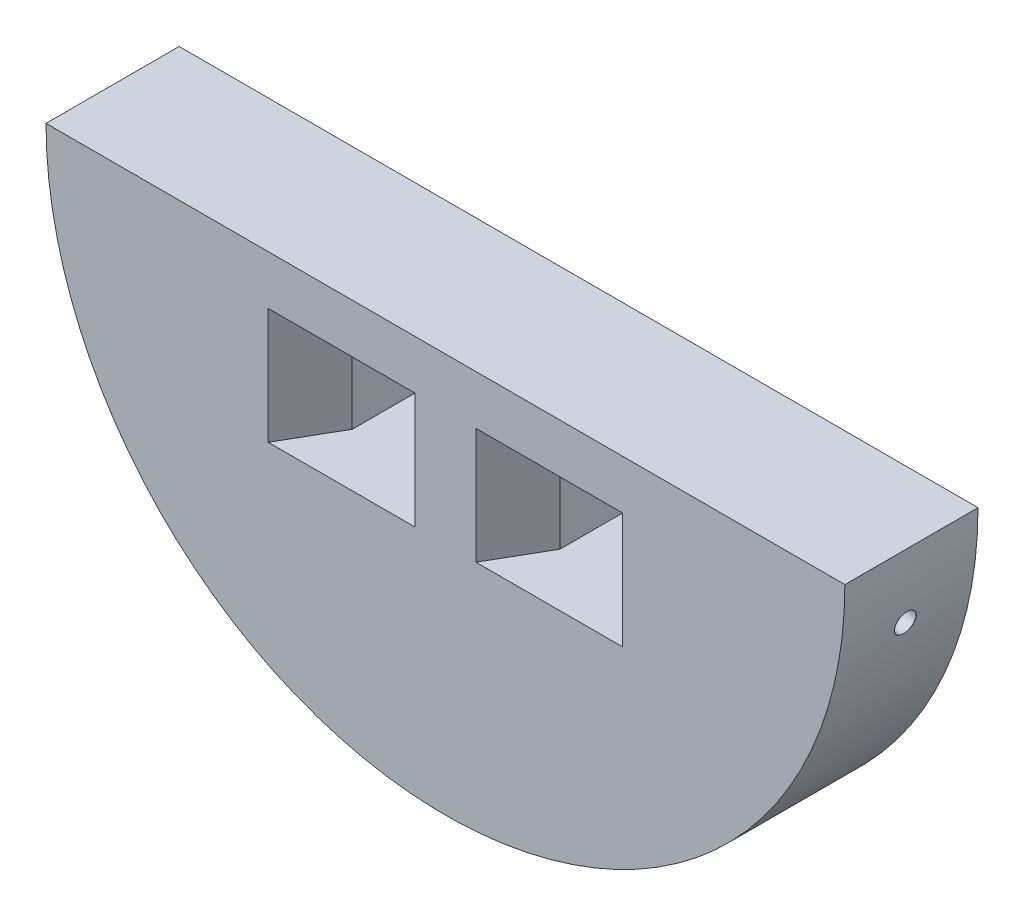
from build123d import *
from OCP.BRepFilletAPI import BRepFilletAPI_MakeChamfer

# Parameters (mm, degrees)
SKETCH1_W           = 16
SKETCH1_H           = 16
BOSS_EXTRUDE1_DEPTH = 25
CIRPATTERN1_COUNT   = 5
CIRPATTERN1_ANGLE   = 160
CHAMFER1_SIZE       = 15
CHAMFER1_SIZE2      = 8.660254038
CHAMFER3_SIZE       = 10
CHAMFER3_SIZE_2     = 5.773502692


with BuildPart() as part:
    # Sketch1 → Boss-Extrude1 (new body)
    with BuildSketch(Plane.XY):
        with BuildLine():
            Line((-150, 0), (0, 0))
            ThreePointArc((0, 0), (-75, -75), (-150, 0))
        make_face()
        with Locations((-55.5, -23)):
            Rectangle(SKETCH1_W, SKETCH1_H, mode=Mode.SUBTRACT)
        with Locations((-94.5, -23)):
            Rectangle(SKETCH1_W, SKETCH1_H, mode=Mode.SUBTRACT)
    extrude(amount=BOSS_EXTRUDE1_DEPTH)

    # Sketch4 → Ø4.0mm Dowel Hole2 (revolve, cut)
    with BuildSketch(Plane(origin=(-1.139418524, -13.023613325, 12.5), x_dir=(0.17364817766693047, 0.9848077530122081, 0), z_dir=(0, 0, 1))):
        Polygon((0, 0), (0, 17.201721238), (2, 16), (2, 0.025), (2.025, 0), align=None)
    f_4_0mm_dowel_hole2 = revolve(axis=Axis((5.114110708, -14.126279253, 12.5), (-0.9848077530122081, 0.17364817766693044, 0)), mode=Mode.SUBTRACT)

    # CirPattern1: Ø4.0mm Dowel Hole2 ×5 about axis
    cirpattern1_axis = Axis((-75, 0, 0), (0, 0, -1))
    for i in range(1, CIRPATTERN1_COUNT):
        add(f_4_0mm_dowel_hole2.rotate(cirpattern1_axis, i * CIRPATTERN1_ANGLE / (CIRPATTERN1_COUNT - 1)), mode=Mode.SUBTRACT)

    # Chamfer1: one chamfer whose edges measure the first distance from different faces: ONE call of the kernel's chamfer builder (chamfer() names one face for all edges)
    chamfer1_edges_1 = [part.edges().sort_by_distance(p)[0] for p in [
        (-55.5, -15, 0),
    ]]
    chamfer1_side_1 = [part.faces().sort_by_distance(p)[0] for p in [
        (-55.5, -15, 12.5),
    ]]
    chamfer1_edges_2 = [part.edges().sort_by_distance(p)[0] for p in [
        (-94.5, -15, 0),
    ]]
    chamfer1_side_2 = [part.faces().sort_by_distance(p)[0] for p in [
        (-94.5, -15, 12.5),
    ]]
    chamfer1 = BRepFilletAPI_MakeChamfer(part.part.solid().wrapped)
    for e in chamfer1_edges_1:
        chamfer1.Add(CHAMFER1_SIZE, CHAMFER1_SIZE2, e.wrapped, chamfer1_side_1[0].wrapped)  # the first distance lies on this face
    for e in chamfer1_edges_2:
        chamfer1.Add(CHAMFER1_SIZE, CHAMFER1_SIZE2, e.wrapped, chamfer1_side_2[0].wrapped)  # the first distance lies on this face
    add(Compound.cast(chamfer1.Shape()), mode=Mode.REPLACE)

    # Chamfer3
    chamfer3_edges_1 = [part.edges().sort_by_distance(p)[0] for p in [
        (-102.5, -23, 25),
    ]]
    chamfer3_side_1 = [part.faces().sort_by_distance(p)[0] for p in [
        (-102.5, -23, 24.884529946),
    ]]
    chamfer3_edges_2 = [part.edges().sort_by_distance(p)[0] for p in [
        (-94.5, -15, 25),
    ]]
    chamfer3_side_2 = [part.faces().sort_by_distance(p)[0] for p in [
        (-94.5, -14.884529946, 25),
    ]]
    chamfer3_edges_3 = [part.edges().sort_by_distance(p)[0] for p in [
        (-86.5, -23, 25),
    ]]
    chamfer3_side_3 = [part.faces().sort_by_distance(p)[0] for p in [
        (-86.5, -23, 24.884529946),
    ]]
    chamfer3_edges_4 = [part.edges().sort_by_distance(p)[0] for p in [
        (-47.5, -23, 25),
    ]]
    chamfer3_side_4 = [part.faces().sort_by_distance(p)[0] for p in [
        (-47.5, -23, 24.884529946),
    ]]
    chamfer3_edges_5 = [part.edges().sort_by_distance(p)[0] for p in [
        (-55.5, -15, 25),
    ]]
    chamfer3_side_5 = [part.faces().sort_by_distance(p)[0] for p in [
        (-55.5, -15, 24.884529946),
    ]]
    chamfer3_edges_6 = [part.edges().sort_by_distance(p)[0] for p in [
        (-63.5, -23, 25),
    ]]
    chamfer3_side_6 = [part.faces().sort_by_distance(p)[0] for p in [
        (-63.5, -23, 24.884529946),
    ]]
    chamfer3 = BRepFilletAPI_MakeChamfer(part.part.solid().wrapped)
    for e in chamfer3_edges_1:
        chamfer3.Add(CHAMFER3_SIZE - 0.0001, CHAMFER3_SIZE_2 - 0.0001, e.wrapped, chamfer3_side_1[0].wrapped)
    for e in chamfer3_edges_2:
        chamfer3.Add(CHAMFER3_SIZE_2 - 0.0001, CHAMFER3_SIZE - 0.0001, e.wrapped, chamfer3_side_2[0].wrapped)
    for e in chamfer3_edges_3:
        chamfer3.Add(CHAMFER3_SIZE - 0.0001, CHAMFER3_SIZE_2 - 0.0001, e.wrapped, chamfer3_side_3[0].wrapped)
    for e in chamfer3_edges_4:
        chamfer3.Add(CHAMFER3_SIZE - 0.0001, CHAMFER3_SIZE_2 - 0.0001, e.wrapped, chamfer3_side_4[0].wrapped)
    for e in chamfer3_edges_5:
        chamfer3.Add(CHAMFER3_SIZE - 0.0001, CHAMFER3_SIZE_2 - 0.0001, e.wrapped, chamfer3_side_5[0].wrapped)
    for e in chamfer3_edges_6:
        chamfer3.Add(CHAMFER3_SIZE - 0.0001, CHAMFER3_SIZE_2 - 0.0001, e.wrapped, chamfer3_side_6[0].wrapped)
    add(Compound.cast(chamfer3.Shape()), mode=Mode.REPLACE)  # a hair under: the kernel refuses the full size


solid = part.part
